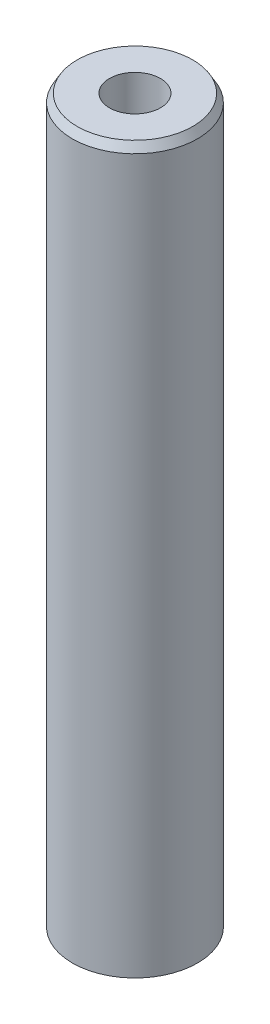
from build123d import *
from OCP.BRepFilletAPI import BRepFilletAPI_MakeChamfer

# Parameters (mm, degrees)
SKETCH1_R           = 17.5
BOSS_EXTRUDE1_DEPTH = 203.347318659
SKETCH2_R           = 7.130837021
CUT_EXTRUDE1_DEPTH  = 205.847826461
CHAMFER1_SIZE       = 2.323541637
CHAMFER1_SIZE2      = 1.34149739


with BuildPart() as part:
    # Sketch1 → Boss-Extrude1 (new body)
    with BuildSketch(Plane(origin=(0, 0, 0), x_dir=(1, 0, 0), z_dir=(0, 1, 0))):
        Circle(SKETCH1_R)
    extrude(amount=BOSS_EXTRUDE1_DEPTH)

    # Sketch2 → Cut-Extrude1 (cut, through all)
    with BuildSketch(Plane(origin=(0, 0, 0), x_dir=(1, 0, 0), z_dir=(0, 1, 0))):
        Circle(SKETCH2_R)
    extrude(amount=CUT_EXTRUDE1_DEPTH, mode=Mode.SUBTRACT)

    # Chamfer1: one chamfer whose edges measure the first distance from different faces: ONE call of the kernel's chamfer builder (chamfer() names one face for all edges)
    chamfer1_edges_1 = [part.edges().sort_by_distance(p)[0] for p in [
        (-17.5, 203.347318659, 0),
    ]]
    chamfer1_side_1 = [part.faces().sort_by_distance(p)[0] for p in [
        (-17.5, 101.67365933, 0),
    ]]
    chamfer1_edges_2 = [part.edges().sort_by_distance(p)[0] for p in [
        (-17.5, 0, 0),
    ]]
    chamfer1_side_2 = [part.faces().sort_by_distance(p)[0] for p in [
        (-17.005025253, 0, 0),
    ]]
    chamfer1 = BRepFilletAPI_MakeChamfer(part.part.solid().wrapped)
    for e in chamfer1_edges_1:
        chamfer1.Add(CHAMFER1_SIZE, CHAMFER1_SIZE2, e.wrapped, chamfer1_side_1[0].wrapped)  # the first distance lies on this face
    for e in chamfer1_edges_2:
        chamfer1.Add(CHAMFER1_SIZE, CHAMFER1_SIZE2, e.wrapped, chamfer1_side_2[0].wrapped)  # the first distance lies on this face
    add(Compound.cast(chamfer1.Shape()), mode=Mode.REPLACE)


solid = part.part
